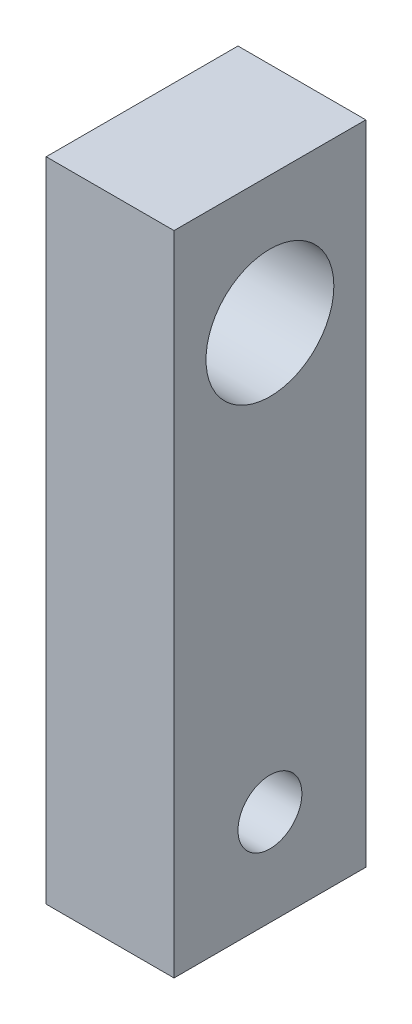
from build123d import *

# Parameters (mm, degrees)
SKETCH5_W           = 6
SKETCH5_H           = 20.25
SKETCH5_R           = 1
SKETCH5_R_2         = 2
BOSS_EXTRUDE2_DEPTH = 4


with BuildPart() as part:
    # Sketch5 → Boss-Extrude2 (new body)
    with BuildSketch(Plane(origin=(0, 0, 0), x_dir=(0, 0, -1), z_dir=(1, 0, 0))):
        with Locations((3, 10.125)):
            Rectangle(SKETCH5_W, SKETCH5_H)
        with Locations((3, 3)):
            Circle(SKETCH5_R, mode=Mode.SUBTRACT)
        with Locations((3, 16.25)):
            Circle(SKETCH5_R_2, mode=Mode.SUBTRACT)
    extrude(amount=BOSS_EXTRUDE2_DEPTH)


solid = part.part
